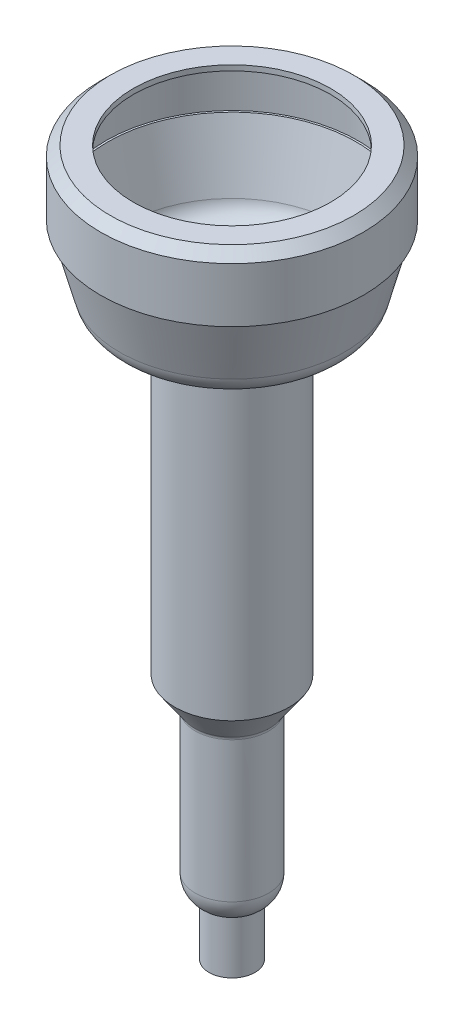
from build123d import *

# Parameters (mm, degrees)
BOSS_EXTRUDE1_DEPTH      = 7
BOSS_EXTRUDE1_DEPTH_BACK = 5
SKETCH2_R                = 1.4
SKETCH3_OUTSIDE_W        = 18.066
SKETCH3_OUTSIDE_H        = 18.066
SKETCH3_OUTSIDE_R        = 0.875
CUT_EXTRUDE1_DEPTH       = 2
FILLET1_R                = 1


with BuildPart() as part:
    # Sketch1 → Revolve2 (revolve)
    with BuildSketch(Plane.XY):
        with BuildLine():
            Line((-3.755778652, 14.546362803), (-4.55, 14.546362803))
            Line((-4.55, 14.546362803), (-4.8, 14.296362803))
            Line((-4.8, 14.296362803), (-4.8, 12.499997602))
            Line((-4.8, 12.499997602), (-4.726187471, 12.499997602))
            Line((-4.726187471, 12.499997602), (-4.085093395, 10.107402835))
            ThreePointArc((-4.085093395, 10.107402835), (-3.828996553, 9.665101687), (-3.348994918, 9.489561582))
            Line((-3.348994918, 9.489561582), (-2, 9.489561582))
            Line((-2, 9.489561582), (-2, -2.631922723))
            Line((-2, -2.631922723), (-1.256169591, -3.694222639))
            ThreePointArc((-1.256169591, -3.694222639), (-1.22925661, -3.748796766), (-1.22, -3.808937926))
            Line((-1.22, -3.808937926), (-1.22, -4.710135178))
            ThreePointArc((-1.22, -4.710135178), (-1.161421356, -4.851556534), (-1.02, -4.910135178))
            Line((-1.02, -4.910135178), (0, -4.910135178))
            Line((0, -4.910135178), (0, -5.090135178))
            Line((0, -5.090135178), (-1.2, -5.090135178))
            ThreePointArc((-1.2, -5.090135178), (-1.341421356, -5.031556534), (-1.4, -4.890135178))
            Line((-1.4, -4.890135178), (-1.4, -3.865691708))
            ThreePointArc((-1.4, -3.865691708), (-1.40925661, -3.805550548), (-1.436169591, -3.750976421))
            Line((-1.436169591, -3.750976421), (-2.18, -2.688676505))
            Line((-2.18, -2.688676505), (-2.18, 9.311323495))
            Line((-2.18, 9.311323495), (-3.548994918, 9.311323495))
            ThreePointArc((-3.548994918, 9.311323495), (-4.027869138, 9.577238986), (-4.280340775, 10.063335313))
            Line((-4.280340775, 10.063335313), (-4.879652854, 12.299997602))
            Line((-4.879652854, 12.299997602), (-5, 12.299997602))
            Line((-5, 12.299997602), (-5, 14.379205516))
            Line((-5, 14.379205516), (-4.632842712, 14.746362803))
            Line((-4.632842712, 14.746362803), (-3.755778652, 14.746362803))
            Line((-3.755778652, 14.746362803), (-3.755778652, 14.546362803))
        make_face()
    revolve(axis=Axis((0, 14.5, 0), (0, -1, 0)))

    # Sketch2 → Boss-Extrude1 (add, two sides: drawn at the far end of the back side and taken through both)
    with BuildSketch(Plane.XZ.offset(5.090135178).offset(-BOSS_EXTRUDE1_DEPTH_BACK)):
        with Locations(Location((0, 0, 0), (0, 0, 180))):
            Circle(SKETCH2_R)
    extrude(amount=BOSS_EXTRUDE1_DEPTH + BOSS_EXTRUDE1_DEPTH_BACK)

    # Sketch3 outside → Cut-Extrude1 (cut)
    with BuildSketch(Plane.XZ.offset(12.090135178)):
        Rectangle(SKETCH3_OUTSIDE_W, SKETCH3_OUTSIDE_H)
        Circle(SKETCH3_OUTSIDE_R, mode=Mode.SUBTRACT)
    extrude(amount=-CUT_EXTRUDE1_DEPTH, mode=Mode.SUBTRACT)

    # Fillet1
    # the kernel refuses this fillet: 1 mm, written as the material it takes off along each edge
    with BuildSketch(Plane(origin=(0, -10.090135178, 0), x_dir=(-1, 0, 0), z_dir=(0, 0, -1))) as fillet1_piece_1:
        with BuildLine():
            CenterArc((0.4, 0.879985795), FILLET1_R, 298.359350028, 61.640649972)
            Line((0.875, 0), (0.8845, -0.017599716))
            ThreePointArc((0.8845, -0.017599716), (1.1375, -0.02), (1.4, -0.02))
            Line((1.4, -0.02), (1.42, 0))
            Line((1.42, 0), (1.42, 0.879985795))
            Line((1.42, 0.879985795), (1.4, 0.879985795))
        make_face()
    revolve(axis=Axis((0, -10.090135178, 0), (0, 1, 0)), mode=Mode.SUBTRACT)


solid = part.part
